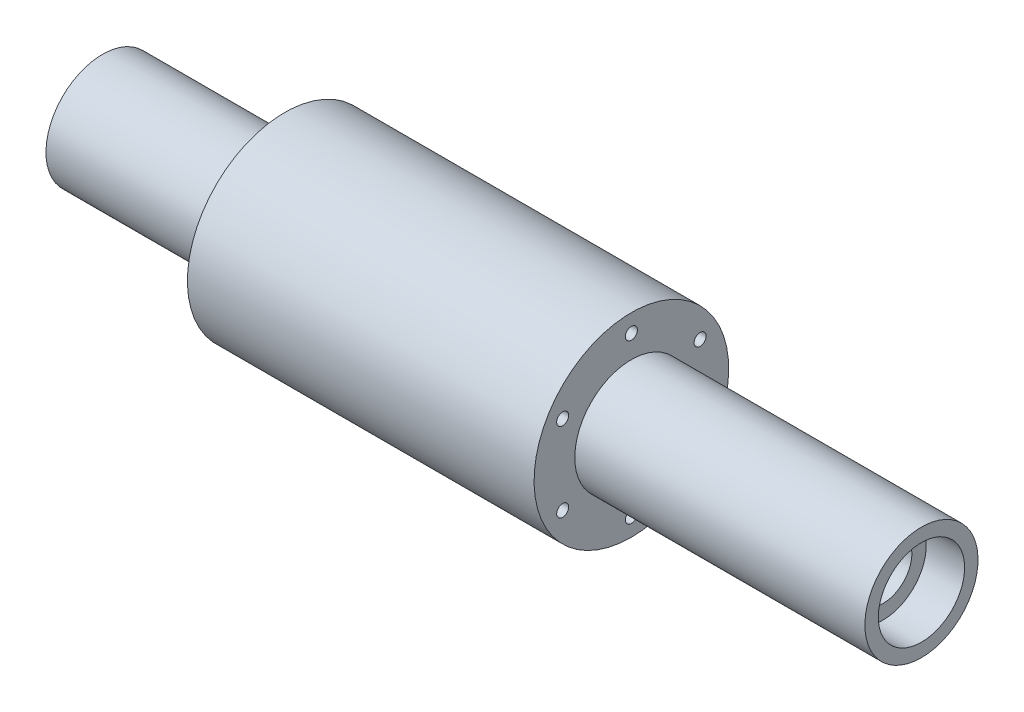
from build123d import *

# Parameters (mm, degrees)
CIRPATTERN1_COUNT   = 6
CUT_EXTRUDE2_START  = 22.15
CUT_EXTRUDE2_DEPTH  = 10
FILLET1_R           = 4
MIRROR1_START       = -36.15
MIRROR1_OUTLINE_R   = 1.25
MIRROR1_DEPTH       = 8.4999999
MIRROR1_START_2     = -28.15
MIRROR1_2_OUTLINE_R = 1.25
MIRROR1_2_DEPTH     = 6
MIRROR1_START_3     = -21
MIRROR1_3_DEPTH     = 21


with BuildPart() as part:
    # Sketch1 → Revolve1 (revolve)
    with BuildSketch(Plane.XY, mode=Mode.PRIVATE) as revolve1_sk:
        Polygon((0, 6), (0, 20.3), (36.15, 20.3), (36.15, 11.8), (96.65, 11.8), (96.65, 9), (88.65, 9), (88.65, 6), align=None)
    revolve(revolve1_sk.sketch.rotate(Axis((-6.306589334, 0, 0), (1, 0, 0)), 180), axis=Axis((-6.306589334, 0, 0), (1, 0, 0)))

    # Sketch4 → M3 Tapped Hole1 (revolve, cut)
    with BuildSketch(Plane(origin=(36.15, 16.55, 0), x_dir=(0, 0, -1), z_dir=(0, 1, 0))):
        Polygon((0, 0), (0, 9.251075774), (1.25, 8.5), (1.25, 0), align=None)
    m3_tapped_hole1 = revolve(axis=Axis((42.5, 16.55, 0), (-1, 0, 0)), mode=Mode.SUBTRACT)

    # CirPattern1: M3 Tapped Hole1 ×6 about axis
    cirpattern1_axis = Axis((0, 0, 0), (1, 0, 0))
    for i in range(1, CIRPATTERN1_COUNT):
        add(m3_tapped_hole1.rotate(cirpattern1_axis, i * 360 / CIRPATTERN1_COUNT), mode=Mode.SUBTRACT)

    # Sketch5 → Cut-Extrude2 (cut)
    with BuildSketch(Plane(origin=(0, 0, 0), x_dir=(0, 0, -1), z_dir=(1, 0, 0)).offset(CUT_EXTRUDE2_START)):
        with BuildLine():
            Line((-6, 0), (-6, -19.393039989))
            ThreePointArc((-6, -19.393039989), (0, -20.3), (6, -19.393039989))
            Line((6, -19.393039989), (6, 0))
            ThreePointArc((6, 0), (0, -6), (-6, 0))
        make_face()
    extrude(amount=CUT_EXTRUDE2_DEPTH, mode=Mode.SUBTRACT)

    # Sketch1<3> → Revolve2 (revolve)
    with BuildSketch(Plane.XY, mode=Mode.PRIVATE) as revolve2_sk:
        Polygon((-66.15, 9), (-66.15, 6), (0, 6), (0, 20.3), (-36.15, 20.3), (-36.15, 11.8), (-74.15, 11.8), (-74.15, 9), align=None)
    revolve(revolve2_sk.sketch.rotate(Axis((-6.306589334, 0, 0), (1, 0, 0)), 180), axis=Axis((-6.306589334, 0, 0), (1, 0, 0)))

    # Fillet1
    # the kernel refuses this fillet: 4 mm, written as the material it adds along each edge
    with BuildSketch(Plane(origin=(32.15, 10, 6), x_dir=(-1, 0, 0), z_dir=(0, -1, 0))) as fillet1_piece_1_section:
        with BuildLine():
            CenterArc((FILLET1_R, FILLET1_R), FILLET1_R, 180, 90)
            Line((0, FILLET1_R), (0, 0))
            Line((0, 0), (FILLET1_R, 0))
        make_face()
    fillet1_piece_1 = extrude(amount=39.393039989, mode=Mode.PRIVATE)
    fillet1_piece_1 = fillet1_piece_1 - Plane(origin=(32.15, 0, 0), x_dir=(0, -1, 0), z_dir=(-1, 0, 0)) * Cylinder(6, 95, mode=Mode.PRIVATE)
    fillet1_piece_1 = fillet1_piece_1 & Plane(origin=(32.15, 0, 0), x_dir=(0, -1, 0), z_dir=(1, 0, 0)) * Cylinder(20.3, 95, mode=Mode.PRIVATE)
    add(fillet1_piece_1)
    with BuildSketch(Plane(origin=(32.15, -29.393039989, -6), x_dir=(-1, 0, 0), z_dir=(0, 1, 0))) as fillet1_piece_2_section:
        with BuildLine():
            CenterArc((FILLET1_R, FILLET1_R), FILLET1_R, 180, 90)
            Line((0, FILLET1_R), (0, 0))
            Line((0, 0), (FILLET1_R, 0))
        make_face()
    fillet1_piece_2 = extrude(amount=39.393039989, mode=Mode.PRIVATE)
    fillet1_piece_2 = fillet1_piece_2 - Plane(origin=(32.15, 0, 0), x_dir=(0, -1, 0), z_dir=(-1, 0, 0)) * Cylinder(6, 95, mode=Mode.PRIVATE)
    fillet1_piece_2 = fillet1_piece_2 & Plane(origin=(32.15, 0, 0), x_dir=(0, -1, 0), z_dir=(1, 0, 0)) * Cylinder(20.3, 95, mode=Mode.PRIVATE)
    add(fillet1_piece_2)
    with BuildSketch(Plane(origin=(22.15, 10, 6), x_dir=(0, 0, -1), z_dir=(0, -1, 0))) as fillet1_piece_3_section:
        with BuildLine():
            CenterArc((FILLET1_R, FILLET1_R), FILLET1_R, 180, 90)
            Line((0, FILLET1_R), (0, 0))
            Line((0, 0), (FILLET1_R, 0))
        make_face()
    fillet1_piece_3 = extrude(amount=39.393039989, mode=Mode.PRIVATE)
    fillet1_piece_3 = fillet1_piece_3 - Plane(origin=(22.15, 0, 0), x_dir=(0, -1, 0), z_dir=(-1, 0, 0)) * Cylinder(6, 95, mode=Mode.PRIVATE)
    fillet1_piece_3 = fillet1_piece_3 & Plane(origin=(22.15, 0, 0), x_dir=(0, -1, 0), z_dir=(1, 0, 0)) * Cylinder(20.3, 95, mode=Mode.PRIVATE)
    add(fillet1_piece_3)
    with BuildSketch(Plane(origin=(22.15, -29.393039989, -6), x_dir=(1, 0, 0), z_dir=(0, 1, 0))) as fillet1_piece_4_section:
        with BuildLine():
            CenterArc((FILLET1_R, -FILLET1_R), FILLET1_R, 90, 90)
            Line((0, -FILLET1_R), (0, 0))
            Line((0, 0), (FILLET1_R, 0))
        make_face()
    fillet1_piece_4 = extrude(amount=39.393039989, mode=Mode.PRIVATE)
    fillet1_piece_4 = fillet1_piece_4 - Plane(origin=(22.15, 0, 0), x_dir=(0, -1, 0), z_dir=(-1, 0, 0)) * Cylinder(6, 95, mode=Mode.PRIVATE)
    fillet1_piece_4 = fillet1_piece_4 & Plane(origin=(22.15, 0, 0), x_dir=(0, -1, 0), z_dir=(1, 0, 0)) * Cylinder(20.3, 95, mode=Mode.PRIVATE)
    add(fillet1_piece_4)

    # Mirror1: read off the stored shape, not the designer's step
    # Mirror1 outline → Mirror1 (cut)
    with BuildSketch(Plane.YZ.offset(MIRROR1_START)):
        with Locations((8.275, -14.332720433)):
            Circle(MIRROR1_OUTLINE_R)
        with Locations((-8.275, -14.332720433)):
            Circle(MIRROR1_OUTLINE_R)
        with Locations((-16.55, 0)):
            Circle(MIRROR1_OUTLINE_R)
        with Locations((-8.275, 14.332720433)):
            Circle(MIRROR1_OUTLINE_R)
        with Locations((8.275, 14.332720433)):
            Circle(MIRROR1_OUTLINE_R)
        with Locations((16.55, 0)):
            Circle(MIRROR1_OUTLINE_R)
    extrude(amount=MIRROR1_DEPTH, mode=Mode.SUBTRACT)

    # Mirror1 2 outline → Mirror1 2 (cut)
    with BuildSketch(Plane.YZ.offset(MIRROR1_START_2)):
        with Locations((-16.55, 0)):
            Circle(MIRROR1_2_OUTLINE_R)
    extrude(amount=MIRROR1_2_DEPTH, mode=Mode.SUBTRACT)

    # Mirror1 3 outline → Mirror1 3 (cut)
    with BuildSketch(Plane(origin=(0, 0, 0), x_dir=(1, 0, 0), z_dir=(0, 1, 0)).offset(MIRROR1_START_3)):
        with BuildLine():
            ThreePointArc((-28.15, 6), (-30.978427125, 4.828427125), (-32.15, 2))
            Line((-32.15, 2), (-32.15, -2))
            ThreePointArc((-32.15, -2), (-30.978427125, -4.828427125), (-28.15, -6))
            Line((-28.15, -6), (-26.15, -6))
            ThreePointArc((-26.15, -6), (-23.321572875, -4.828427125), (-22.15, -2))
            Line((-22.15, -2), (-22.15, 2))
            ThreePointArc((-22.15, 2), (-23.321572875, 4.828427125), (-26.15, 6))
            Line((-26.15, 6), (-28.15, 6))
        make_face()
    extrude(amount=MIRROR1_3_DEPTH, mode=Mode.SUBTRACT)

    # Mirror1 4 outline → Mirror1 4 (revolve, cut)
    with BuildSketch(Plane(origin=(0, 8.275, -14.332720433), x_dir=(0, 1, 0), z_dir=(0, 0, -1))):
        Polygon((1.25, -27.65), (0, -26.898924226), (0, -27.6500001), align=None)
    revolve(axis=Axis((0, 8.275, -14.332720433), (1, 0, 0)), mode=Mode.SUBTRACT)

    # Mirror1 5 outline → Mirror1 5 (revolve, cut)
    with BuildSketch(Plane(origin=(0, -8.275, -14.332720433), x_dir=(0, 1, 0), z_dir=(0, 0, -1))):
        Polygon((1.25, -27.65), (0, -26.898924226), (0, -27.6500001), align=None)
    revolve(axis=Axis((0, -8.275, -14.332720433), (1, 0, 0)), mode=Mode.SUBTRACT)

    # Mirror1 6 outline → Mirror1 6 (revolve, cut)
    with BuildSketch(Plane(origin=(0, -8.275, 14.332720433), x_dir=(0, 1, 0), z_dir=(0, 0, -1))):
        Polygon((1.25, -27.65), (0, -26.898924226), (0, -27.6500001), align=None)
    revolve(axis=Axis((0, -8.275, 14.332720433), (1, 0, 0)), mode=Mode.SUBTRACT)

    # Mirror1 7 outline → Mirror1 7 (revolve, cut)
    with BuildSketch(Plane(origin=(0, 8.275, 14.332720433), x_dir=(0, 1, 0), z_dir=(0, 0, -1))):
        Polygon((1.25, -27.65), (0, -26.898924226), (0, -27.6500001), align=None)
    revolve(axis=Axis((0, 8.275, 14.332720433), (1, 0, 0)), mode=Mode.SUBTRACT)

    # Mirror1 8 outline → Mirror1 8 (revolve, cut)
    with BuildSketch(Plane(origin=(0, 16.55, 0), x_dir=(0, 1, 0), z_dir=(0, 0, -1))):
        Polygon((1.25, -27.65), (0, -26.898924226), (0, -27.6500001), align=None)
    revolve(axis=Axis((0, 16.55, 0), (1, 0, 0)), mode=Mode.SUBTRACT)


solid = part.part
